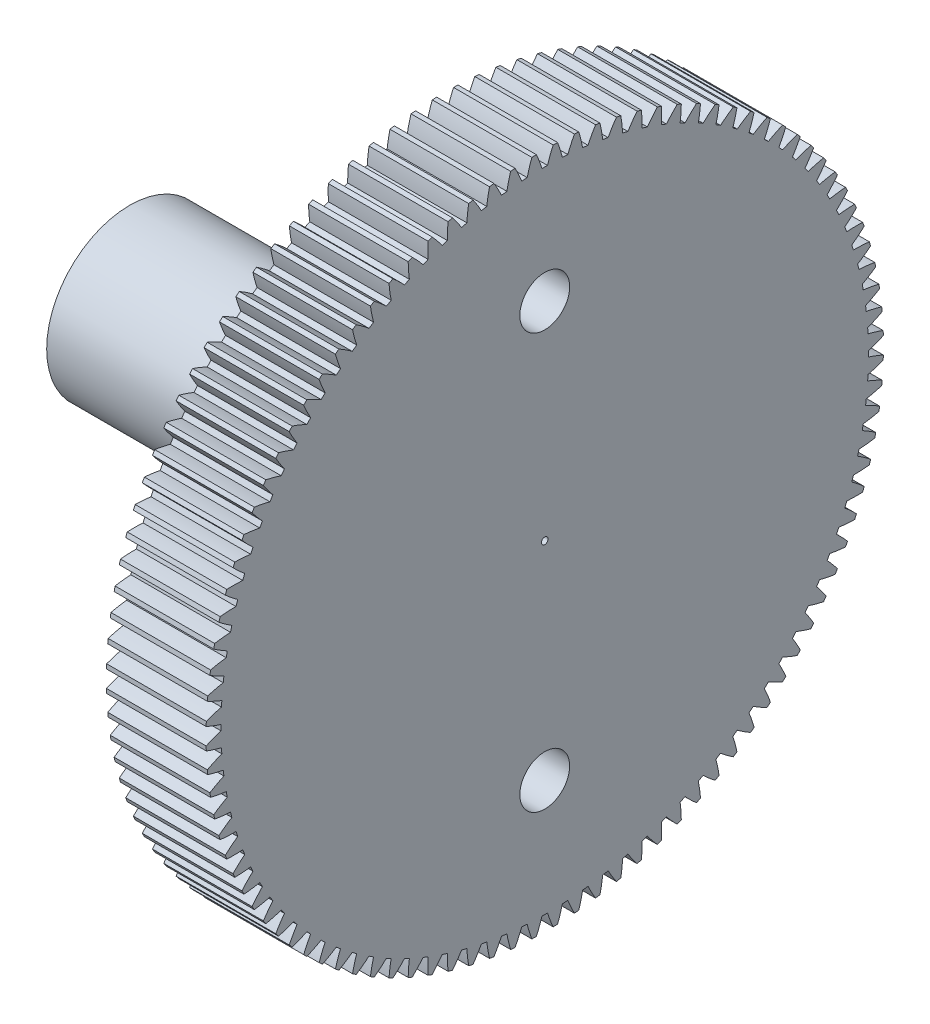
from build123d import *

# Parameters (mm, degrees)
BASPROSKE_W        = 12
BASPROSKE_H        = 40.8
TOOTHCUT_DEPTH     = 59.934539957
TEETHCUTS_COUNT    = 100
TEETHCUTS_ANGLE    = 356.4
HUBNEAONESKE_R     = 10
HUBNEARONE_DEPTH   = 38.0000508
BORSKE_R           = 0.4
BORE_DEPTH         = 50.0000508
SKETCH1_R          = 3
CUT_EXTRUDE1_DEPTH = 20


with BuildPart() as part:
    # BasProSke → Base-Revolve (revolve)
    with BuildSketch(Plane(origin=(0, 0, 0), x_dir=(1, 0, 0), z_dir=(0, 1, 0))):
        with Locations((6, 20.4)):
            Rectangle(BASPROSKE_W, BASPROSKE_H)
    revolve(axis=Axis((-10, 0, 0), (1, 0, 0)))

    # TooCutSke → ToothCut (cut, through all)
    with BuildSketch(Plane(origin=(0, 0, 0), x_dir=(0, 0, -1), z_dir=(1, 0, 0))):
        with BuildLine():
            ThreePointArc((0.330999362, 38.997595316), (0, 38.999), (-0.330999362, 38.997595316))
            ThreePointArc((-0.330999362, 38.997595316), (-0.650493595, 39.915608602), (-1.025143027, 40.812527083))
            ThreePointArc((-1.025143027, 40.812527083), (0, 40.8254), (1.025143027, 40.812527083))
            ThreePointArc((1.025143027, 40.812527083), (0.650493595, 39.915608602), (0.330999362, 38.997595316))
        make_face()
    toothcut = extrude(amount=TOOTHCUT_DEPTH, mode=Mode.SUBTRACT)

    # TeethCuts: ToothCut ×100 about axis
    teethcuts_axis = Axis((-10, 0, 0), (1, 0, 0))
    for i in range(1, TEETHCUTS_COUNT):
        add(toothcut.rotate(teethcuts_axis, i * TEETHCUTS_ANGLE / (TEETHCUTS_COUNT - 1)), mode=Mode.SUBTRACT)

    # HubNeaOneSke → HubNearOne (add)
    with BuildSketch(Plane.ZY):
        Circle(HUBNEAONESKE_R)
    extrude(amount=HUBNEARONE_DEPTH)

    # BorSke → Bore (cut, symmetric)
    with BuildSketch(Plane(origin=(0, 0, 0), x_dir=(0, 0, -1), z_dir=(1, 0, 0))):
        Circle(BORSKE_R)
    extrude(amount=BORE_DEPTH, both=True, mode=Mode.SUBTRACT)

    # Sketch1 → Cut-Extrude1 (cut)
    with BuildSketch(Plane(origin=(12, 0, 0), x_dir=(0, 0, -1), z_dir=(1, 0, 0))):
        with Locations((-5e-05, 25)):
            Circle(SKETCH1_R)
        with Locations((-5e-05, -25)):
            Circle(SKETCH1_R)
    extrude(amount=-CUT_EXTRUDE1_DEPTH, mode=Mode.SUBTRACT)


solid = part.part
